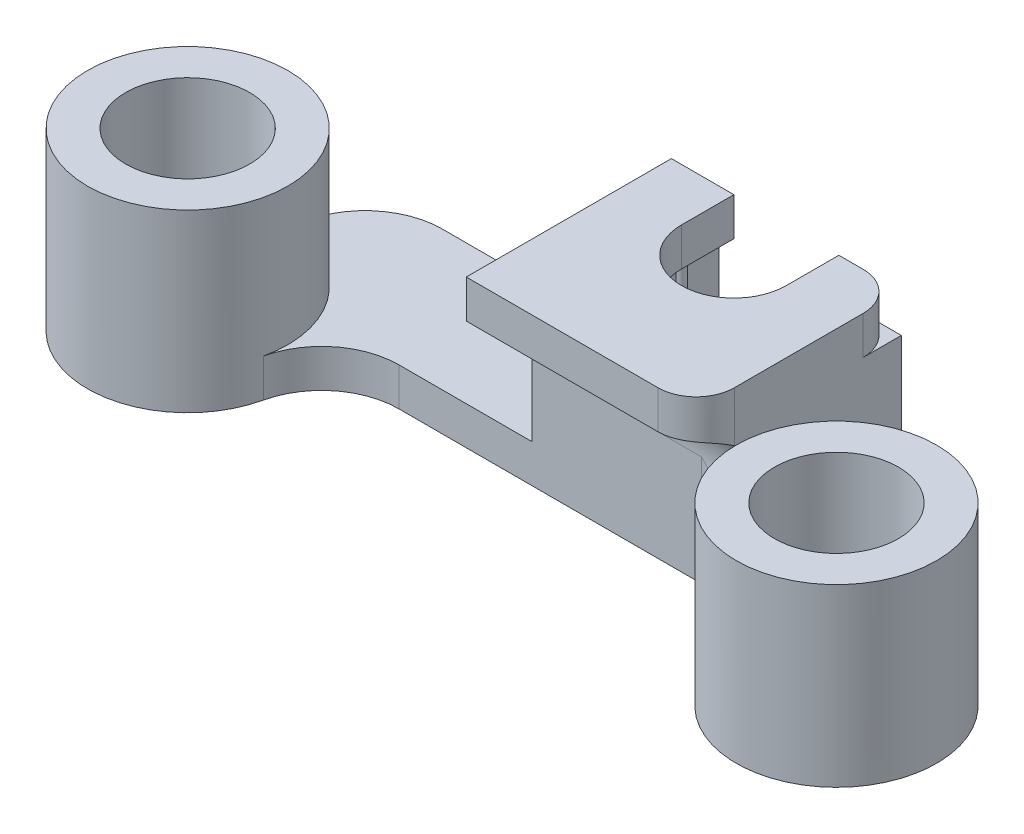
from build123d import *

# Parameters (mm, degrees)
SKETCH1_R             = 5.25
SKETCH1_R_2           = 3.25
BOSS_EXTRUDE1_DEPTH   = 9.2
BOSS_EXTRUDE1_2_DEPTH = 9.2
BOSS_EXTRUDE2_DEPTH   = 2
SKETCH3_W             = 2.5
SKETCH3_H             = 7.3
BOSS_EXTRUDE3_DEPTH   = 7.2
BOSS_EXTRUDE4_DEPTH   = 2
SKETCH6_R             = 0.25
BOSS_EXTRUDE5_DEPTH   = 7.2
BOSS_EXTRUDE6_REACH   = 27.811
SKETCH7_W             = 7.05
SKETCH7_H             = 1
FILLET3_R             = 3.45
FILLET4_DEPTH         = 2
FILLET4_2_DEPTH       = 2
FILLET4_START         = 2
FILLET4_3_DEPTH       = 0.883001
FILLET4_START_2       = 7.928754
FILLET4_4_DEPTH       = 3.171246
FILLET4_START_3       = 2.883001
FILLET4_5_DEPTH       = 2.866999


with BuildPart() as part:
    # Sketch1 → Boss-Extrude1 (new body)
    with BuildSketch(Plane(origin=(0, 0, 0), x_dir=(1, 0, 0), z_dir=(0, 1, 0))):
        with Locations(Location((-17, 0, 0), (0, 0, 270))):
            Circle(SKETCH1_R)
        with Locations(Location((-17, 0, 0), (0, 0, 270))):
            Circle(SKETCH1_R_2, mode=Mode.SUBTRACT)
    extrude(amount=BOSS_EXTRUDE1_DEPTH)



with BuildPart() as body_2:
    # Sketch1 → Boss-Extrude1 2 (new body)
    with BuildSketch(Plane(origin=(0, 0, 0), x_dir=(1, 0, 0), z_dir=(0, 1, 0))):
        with Locations(Location((17, 0, 0), (0, 0, 90))):
            Circle(SKETCH1_R)
        with Locations(Location((17, 0, 0), (0, 0, 90))):
            Circle(SKETCH1_R_2, mode=Mode.SUBTRACT)
    extrude(amount=BOSS_EXTRUDE1_2_DEPTH)


with BuildPart() as part_1:
    add(part.part)

    add(body_2.part)  # Boss-Extrude2 merges body 2
    # Sketch2 → Boss-Extrude2 (add)
    with BuildSketch(Plane(origin=(0, 0, 0), x_dir=(1, 0, 0), z_dir=(0, 1, 0))):
        with BuildLine():
            Line((17, 9.3), (-17, 9.3))
            Line((-17, 9.3), (-17, 3.25))
            ThreePointArc((-17, 3.25), (-15.574781, 2.92083), (-14.438262, 2))
            Line((-14.438262, 2), (14.438262, 2))
            ThreePointArc((14.438262, 2), (15.574781, 2.92083), (17, 3.25))
            Line((17, 3.25), (17, 9.3))
        make_face()
    extrude(amount=BOSS_EXTRUDE2_DEPTH)

    # Sketch3 → Boss-Extrude3 (add)
    with BuildSketch(Plane(origin=(0, 2, 0), x_dir=(1, 0, 0), z_dir=(0, 1, 0))):
        with Locations((0.3, 5.65)):
            Rectangle(SKETCH3_W, SKETCH3_H)
        with Locations((9.85, 5.65)):
            Rectangle(SKETCH3_W, SKETCH3_H)
    extrude(amount=BOSS_EXTRUDE3_DEPTH)

    # Sketch5 → Boss-Extrude4 (add)
    with BuildSketch(Plane(origin=(0, 9.2, 0), x_dir=(1, 0, 0), z_dir=(0, 1, 0))):
        with BuildLine():
            Line((1.55, 9.3), (-0.95, 9.3))
            Line((-0.95, 9.3), (-0.95, -1.45))
            Line((-0.95, -1.45), (9.1, -1.45))
            ThreePointArc((9.1, -1.45), (10.514214, -0.864214), (11.1, 0.55))
            Line((11.1, 0.55), (11.1, 2))
            Line((11.1, 2), (8.6, 2))
            Line((8.6, 2), (1.55, 2))
            Line((1.55, 2), (1.55, 9.3))
        make_face()
        with BuildLine():
            Line((8.6, 9.3), (8.6, 2))
            Line((8.6, 2), (11.1, 2))
            Line((11.1, 2), (11.1, 7.3))
            ThreePointArc((11.1, 7.3), (10.514214, 8.714214), (9.1, 9.3))
            Line((9.1, 9.3), (8.6, 9.3))
        make_face()
        with BuildLine():
            Line((2.325, 9.3), (1.55, 9.3))
            Line((1.55, 9.3), (1.55, 2))
            Line((1.55, 2), (8.6, 2))
            Line((8.6, 2), (8.6, 9.3))
            Line((8.6, 9.3), (7.825, 9.3))
            Line((7.825, 9.3), (7.825, 6.55))
            ThreePointArc((7.825, 6.55), (5.075, 3.8), (2.325, 6.55))
            Line((2.325, 6.55), (2.325, 9.3))
        make_face()
    extrude(amount=BOSS_EXTRUDE4_DEPTH)

    # Sketch6 → Boss-Extrude5 (add)
    with BuildSketch(Plane(origin=(0, 2, 0), x_dir=(1, 0, 0), z_dir=(0, 1, 0))):
        with Locations((1.55, 7.3)):
            Circle(SKETCH6_R)
        with Locations((1.55, 4)):
            Circle(SKETCH6_R)
        with Locations((8.6, 7.3)):
            Circle(SKETCH6_R)
        with Locations((8.6, 4)):
            Circle(SKETCH6_R)
    extrude(amount=BOSS_EXTRUDE5_DEPTH)

    # Sketch7 → Boss-Extrude6 (add, up to next)
    with BuildSketch(Plane(origin=(0, 2, 0), x_dir=(1, 0, 0), z_dir=(0, 1, 0)), mode=Mode.PRIVATE) as boss_extrude6_sk1:
        with Locations((5.075, 2.5)):
            Rectangle(SKETCH7_W, SKETCH7_H)
    boss_extrude6_tool1 = extrude(boss_extrude6_sk1.sketch, amount=BOSS_EXTRUDE6_REACH, mode=Mode.PRIVATE) - part_1.part
    add(boss_extrude6_tool1.solids().sort_by_distance((5.075, 2, -2.5))[0])

    # Fillet3
    fillet3_edges = [part_1.edges().sort_by_distance(p)[0] for p in [
        (5.075, 9.2, -2),
    ]]
    fillet(fillet3_edges, radius=FILLET3_R - 0.0001)  # a hair under: the kernel refuses the full size

    # Fillet4: read off the stored shape, not the designer's step
    # Fillet4 outline → Fillet4 (cut)
    with BuildSketch(Plane(origin=(0, 0, 0), x_dir=(1, 0, 0), z_dir=(0, 1, 0))):
        with BuildLine():
            ThreePointArc((12.95, 9.3), (15.813782, 8.113782), (17, 5.25))
            Line((17, 5.25), (17, 9.3))
            Line((17, 9.3), (12.95, 9.3))
        make_face()
        with BuildLine():
            ThreePointArc((-17, 5.25), (-15.813782, 8.113782), (-12.95, 9.3))
            Line((-12.95, 9.3), (-17, 9.3))
            Line((-17, 9.3), (-17, 5.25))
        make_face()
    extrude(amount=FILLET4_DEPTH, mode=Mode.SUBTRACT)

    # Fillet4 2 outline → Fillet4 2 (add)
    with BuildSketch(Plane(origin=(0, 0, 0), x_dir=(1, 0, 0), z_dir=(0, 1, 0))):
        with BuildLine():
            ThreePointArc((7.928754, 2), (10.457281, 1.113709), (11.879135, -1.157258))
            ThreePointArc((11.879135, -1.157258), (11.768637, 0.441974), (12.145878, 2))
            Line((12.145878, 2), (7.928754, 2))
        make_face()
        with BuildLine():
            ThreePointArc((-11.879135, -1.157258), (-10.457281, 1.113709), (-7.928754, 2))
            Line((-7.928754, 2), (-12.145878, 2))
            ThreePointArc((-12.145878, 2), (-11.768637, 0.441974), (-11.879135, -1.157258))
        make_face()
    extrude(amount=FILLET4_2_DEPTH)

    # Fillet4 3 outline → Fillet4 3 (add)
    with BuildSketch(Plane(origin=(0, 0, 0), x_dir=(1, 0, 0), z_dir=(0, 1, 0)).offset(FILLET4_START)):
        with BuildLine():
            ThreePointArc((7.928754, 2), (9.689475, 1.59724), (11.1, 0.469067))
            Line((11.1, 0.469067), (11.1, 2))
            Line((11.1, 2), (7.928754, 2))
        make_face()
    extrude(amount=FILLET4_3_DEPTH)

    # Fillet4 4 outline → Fillet4 4 (add)
    with BuildSketch(Plane.YZ.offset(FILLET4_START_2)):
        with BuildLine():
            ThreePointArc((5.75, -2), (4.124928, -1.593294), (2.883001, -0.469067))
            Line((2.883001, -0.469067), (2.883001, -2))
            Line((2.883001, -2), (5.75, -2))
        make_face()
    extrude(amount=FILLET4_4_DEPTH)

    # Fillet4 5 outline → Fillet4 5 (cut)
    with BuildSketch(Plane(origin=(0, 0, 0), x_dir=(1, 0, 0), z_dir=(0, 1, 0)).offset(FILLET4_START_3)):
        with BuildLine():
            ThreePointArc((11.840276, -1), (10.393506, 1.163643), (7.928754, 2))
            Line((7.928754, 2), (7.928754, -1))
            Line((7.928754, -1), (11.840276, -1))
        make_face()
    extrude(amount=FILLET4_5_DEPTH, mode=Mode.SUBTRACT)


solid = part_1.part
